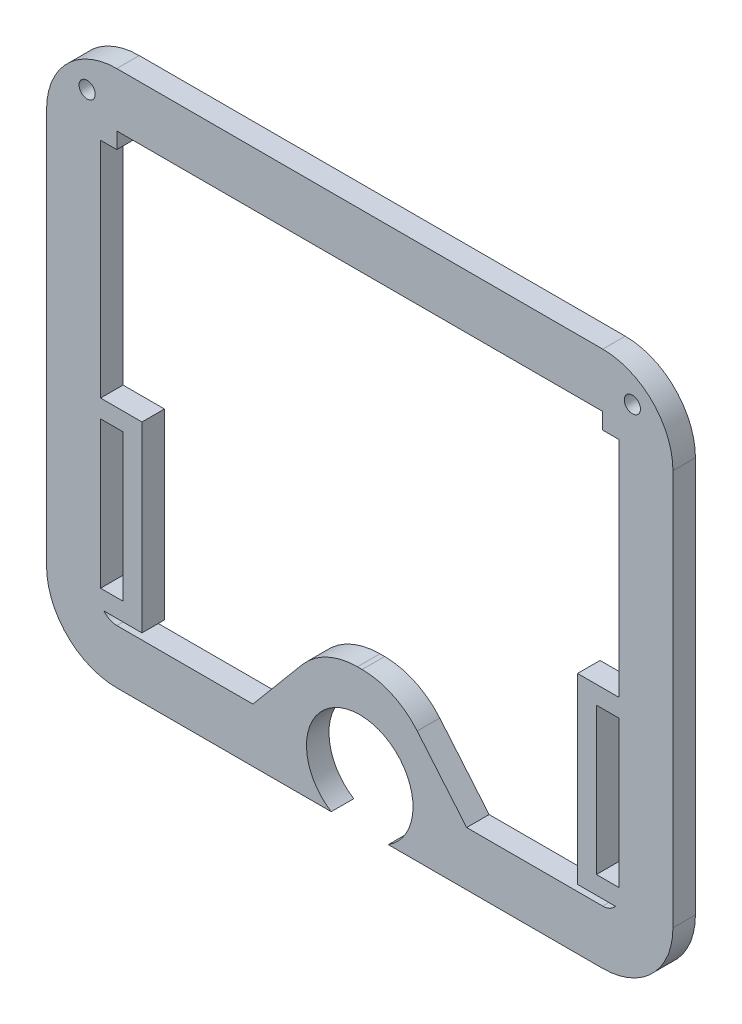
from build123d import *

# Parameters (mm, degrees)
SKETCH1_R           = 0.5715
BOSS_EXTRUDE1_DEPTH = 1.5875
SKETCH2_W           = 1.5875
SKETCH2_H           = 12.890515608
BOSS_EXTRUDE2_DEPTH = 2.921
CUT_EXTRUDE1_DEPTH  = 1.5875


with BuildPart() as part:
    # Sketch1 → Boss-Extrude1 (new body)
    with BuildSketch(Plane.XY):
        with BuildLine():
            Line((-17.145, -18.923), (-2.01269959, -18.923))
            ThreePointArc((-2.01269959, -18.923), (0, -11.9888), (2.01269959, -18.923))
            Line((2.01269959, -18.923), (17.145, -18.923))
            ThreePointArc((17.145, -18.923), (20.647299887, -17.472299887), (22.098, -13.97))
            Line((22.098, -13.97), (22.098, 13.97))
            ThreePointArc((22.098, 13.97), (20.647299887, 17.472299887), (17.145, 18.923))
            Line((17.145, 18.923), (-17.145, 18.923))
            ThreePointArc((-17.145, 18.923), (-20.647299887, 17.472299887), (-22.098, 13.97))
            Line((-22.098, 13.97), (-22.098, -13.97))
            ThreePointArc((-22.098, -13.97), (-20.647299887, -17.472299887), (-17.145, -18.923))
        make_face()
        with Locations((-19.235240854, 16.588113494)):
            Circle(SKETCH1_R, mode=Mode.SUBTRACT)
        with Locations((19.235240854, 16.588113494)):
            Circle(SKETCH1_R, mode=Mode.SUBTRACT)
        with BuildLine():
            Line((-18.288, 13.97), (-18.288, -13.97))
            ThreePointArc((-18.288, -13.97), (-17.953223051, -14.778223051), (-17.145, -15.113))
            Line((-17.145, -15.113), (-7.542517063, -15.113))
            Line((-7.542517063, -15.113), (-4.056594232, -10.958638943))
            ThreePointArc((-4.056594232, -10.958638943), (-2.31198923, -9.619956442), (-0.165088461, -9.144))
            Line((-0.165088461, -9.144), (0.165088461, -9.144))
            ThreePointArc((0.165088461, -9.144), (2.31198923, -9.619956442), (4.056594232, -10.958638943))
            Line((4.056594232, -10.958638943), (7.542517063, -15.113))
            Line((7.542517063, -15.113), (17.145, -15.113))
            ThreePointArc((17.145, -15.113), (17.953223051, -14.778223051), (18.288, -13.97))
            Line((18.288, -13.97), (18.288, 13.97))
            Line((18.288, 13.97), (17.145, 13.97))
            Line((17.145, 13.97), (17.145, 15.113))
            Line((17.145, 15.113), (-17.145, 15.113))
            Line((-17.145, 15.113), (-17.145, 13.97))
            Line((-17.145, 13.97), (-18.288, 13.97))
        make_face(mode=Mode.SUBTRACT)
    extrude(amount=BOSS_EXTRUDE1_DEPTH)

    # Sketch2 → Boss-Extrude2 (add)
    with BuildSketch(Plane(origin=(-18.288, 0, 0), x_dir=(0, 0, -1), z_dir=(1, 0, 0))):
        with Locations((-0.79375, -8.2296)):
            Rectangle(SKETCH2_W, SKETCH2_H)
    boss_extrude2 = extrude(amount=BOSS_EXTRUDE2_DEPTH)

    # Sketch2<3> → Cut-Extrude1 (cut)
    with BuildSketch(Plane(origin=(-18.288, 0, 0), x_dir=(0, 0, -1), z_dir=(1, 0, 0))):
        Polygon((0, -5.596105419), (0, -3.054342196), (-1.5875, -3.054342196), (-1.5875, -6.644691549), (-1.5875, -7.914691549), (-1.5875, -13.404857804), (0, -13.404857804), (0, -7.914691549), align=None)
    cut_extrude1 = extrude(amount=CUT_EXTRUDE1_DEPTH, mode=Mode.SUBTRACT)

    # Mirror1: Boss-Extrude2, Cut-Extrude1 across plane
    add(boss_extrude2.mirror(Plane(origin=(0, 0, 0), x_dir=(0, 0, 1), z_dir=(1, 0, 0))))
    add(cut_extrude1.mirror(Plane(origin=(0, 0, 0), x_dir=(0, 0, 1), z_dir=(1, 0, 0))), mode=Mode.SUBTRACT)


solid = part.part
